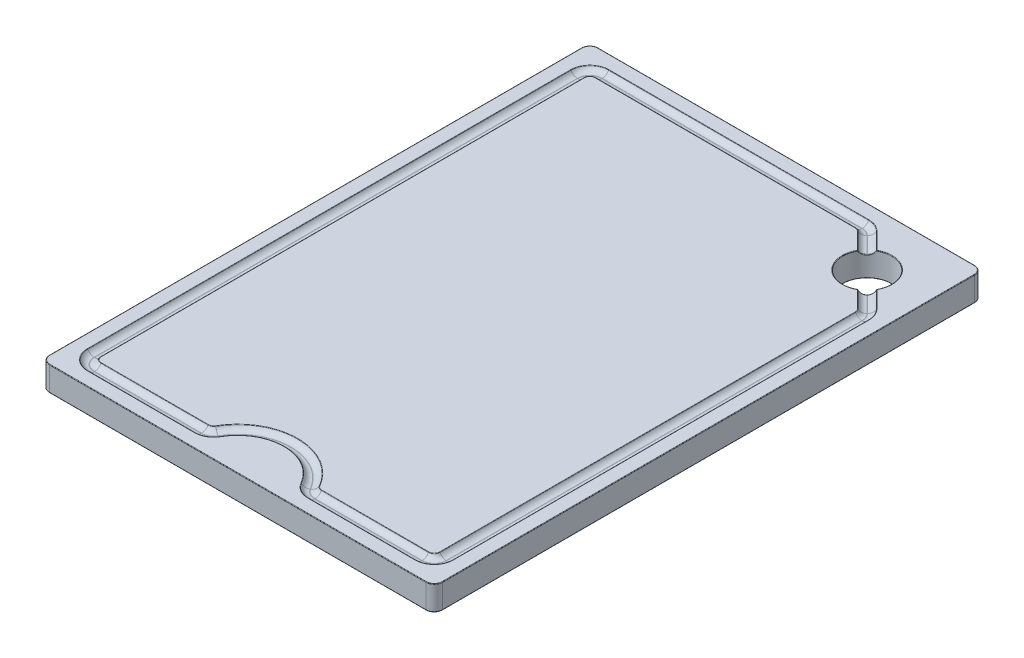
from build123d import *

# Parameters (mm, degrees)
BOARDBOSS_EXTRUDE_DEPTH         = 3.175
BOARDBOSS_EXTRUDE_DEPTH_BACK    = 15.875
CUTTINGBOARDSKETCH_W            = 304.8
CUTTINGBOARDSKETCH_H            = 425.45
BOARDDRAINCUT_EXTRUDE_START     = 3.175
BOARDDRAINCUT_EXTRUDE_DEPTH     = 3.175
BOARDDRAINFILLET_R              = 5.55625
BOARDHOLECUT_EXTRUDE_DEPTH      = 564.49765472
BOARDHOLECUT_EXTRUDE_DEPTH_BACK = 564.49765472
CUTTINGBOARDSKETCH_4_R          = 19.05
BOARDCORNERSFILLET_R            = 6.35
FINISHINGFILLET_R               = 0.396875


with BuildPart() as part:
    # CuttingBoardSketch → BoardBoss-Extrude (new, two sides: drawn at the far end of the back side and taken through both)
    with BuildSketch(Plane(origin=(0, 0, 0), x_dir=(1, 0, 0), z_dir=(0, 1, 0)).offset(-BOARDBOSS_EXTRUDE_DEPTH_BACK)):
        with Locations((180.975, 241.3)):
            Rectangle(CUTTINGBOARDSKETCH_W, CUTTINGBOARDSKETCH_H)
    extrude(amount=BOARDBOSS_EXTRUDE_DEPTH + BOARDBOSS_EXTRUDE_DEPTH_BACK)

    # CuttingBoardSketch<3> → BoardDrainCut-Extrude (cut)
    with BuildSketch(Plane(origin=(0, 0, 0), x_dir=(1, 0, 0), z_dir=(0, 1, 0)).offset(BOARDDRAINCUT_EXTRUDE_START)):
        with BuildLine():
            Line((255.610865818, 443.309375), (53.975, 443.309375))
            ThreePointArc((53.975, 443.309375), (43.59157886, 439.00842114), (39.290625, 428.625))
            Line((39.290625, 428.625), (39.290625, 53.975))
            ThreePointArc((39.290625, 53.975), (43.59157886, 43.59157886), (53.975, 39.290625))
            Line((53.975, 39.290625), (136.980909488, 39.290625))
            ThreePointArc((136.980909488, 39.290625), (144.323096988, 41.257958211), (149.697951276, 46.6328125))
            ThreePointArc((149.697951276, 46.6328125), (180.975, 64.690625), (212.252048724, 46.6328125))
            ThreePointArc((212.252048724, 46.6328125), (217.626903012, 41.257958211), (224.969090512, 39.290625))
            Line((224.969090512, 39.290625), (307.975, 39.290625))
            ThreePointArc((307.975, 39.290625), (318.35842114, 43.59157886), (322.659375, 53.975))
            Line((322.659375, 53.975), (322.659375, 376.260865818))
            ThreePointArc((322.659375, 376.260865818), (321.54159351, 381.880332846), (318.35842114, 386.644286958))
            Line((318.35842114, 386.644286958), (265.994286958, 439.00842114))
            ThreePointArc((265.994286958, 439.00842114), (261.230332846, 442.19159351), (255.610865818, 443.309375))
        make_face()
        with BuildLine():
            Line((255.610865818, 432.990625), (53.975, 432.990625))
            ThreePointArc((53.975, 432.990625), (50.888036958, 431.711963042), (49.609375, 428.625))
            Line((49.609375, 428.625), (49.609375, 53.975))
            ThreePointArc((49.609375, 53.975), (50.888036958, 50.888036958), (53.975, 49.609375))
            Line((53.975, 49.609375), (136.980909488, 49.609375))
            ThreePointArc((136.980909488, 49.609375), (139.163721988, 50.194257847), (140.761651641, 51.7921875))
            ThreePointArc((140.761651641, 51.7921875), (180.975, 75.009375), (221.188348359, 51.7921875))
            ThreePointArc((221.188348359, 51.7921875), (222.786278012, 50.194257847), (224.969090512, 49.609375))
            Line((224.969090512, 49.609375), (307.975, 49.609375))
            ThreePointArc((307.975, 49.609375), (311.061963042, 50.888036958), (312.340625, 53.975))
            Line((312.340625, 53.975), (312.340625, 376.260865818))
            ThreePointArc((312.340625, 376.260865818), (312.008311584, 377.931518178), (311.061963042, 379.34782886))
            Line((311.061963042, 379.34782886), (258.69782886, 431.711963042))
            ThreePointArc((258.69782886, 431.711963042), (257.281518178, 432.658311584), (255.610865818, 432.990625))
        make_face(mode=Mode.SUBTRACT)
    extrude(amount=-BOARDDRAINCUT_EXTRUDE_DEPTH, mode=Mode.SUBTRACT)

    # BoardDrainFillet
    # the kernel refuses this fillet: 5.55625 mm, written as the material it adds along each edge
    with BuildSketch(Plane(origin=(255.610865818, 0, -428.625), x_dir=(0.7071067811863847, 0, -0.7071067811867102), z_dir=(0.7071067811867102, 0, 0.7071067811863847))) as boarddrainfillet_piece_1:
        with BuildLine():
            CenterArc((9.385740786, 5.55625), BOARDDRAINFILLET_R, 205.376933525, 64.623066475)
            Line((4.365625, 3.175), (4.265222684, 3.127375))
            ThreePointArc((4.265222684, 3.127375), (4.2545, 1.5875), (4.2545, 0))
            Line((4.2545, 0), (4.365625, -0.111125))
            Line((4.365625, -0.111125), (9.385740786, -0.111125))
            Line((9.385740786, -0.111125), (9.385740786, 0))
        make_face()
    revolve(axis=Axis((255.610865818, 0, -428.625), (0, 1, 0)), revolution_arc=45)
    with BuildSketch(Plane(origin=(255.610865818, 0, -432.990625), x_dir=(0, 0, -1), z_dir=(-1, 0, 0))) as boarddrainfillet_piece_2:
        with BuildLine():
            CenterArc((5.020115786, -5.55625), BOARDDRAINFILLET_R, 90, 64.623066475)
            Line((0, -3.175), (-0.100402316, -3.127375))
            ThreePointArc((-0.100402316, -3.127375), (-0.111125, -1.5875), (-0.111125, 0))
            Line((-0.111125, 0), (0, 0.111125))
            Line((0, 0.111125), (5.020115786, 0.111125))
            Line((5.020115786, 0.111125), (5.020115786, 0))
        make_face()
    extrude(amount=201.635865818)
    with BuildSketch(Plane(origin=(53.975, 0, -428.625), x_dir=(0, 0, -1), z_dir=(1, 0, 0))) as boarddrainfillet_piece_3:
        with BuildLine():
            CenterArc((9.385740786, 5.55625), BOARDDRAINFILLET_R, 205.376933525, 64.623066475)
            Line((4.365625, 3.175), (4.265222684, 3.127375))
            ThreePointArc((4.265222684, 3.127375), (4.2545, 1.5875), (4.2545, 0))
            Line((4.2545, 0), (4.365625, -0.111125))
            Line((4.365625, -0.111125), (9.385740786, -0.111125))
            Line((9.385740786, -0.111125), (9.385740786, 0))
        make_face()
    revolve(axis=Axis((53.975, 0, -428.625), (0, 1, 0)), revolution_arc=90)
    with BuildSketch(Plane(origin=(49.609375, 0, -428.625), x_dir=(-1, 0, 0), z_dir=(0, 0, 1))) as boarddrainfillet_piece_4:
        with BuildLine():
            CenterArc((5.020115786, -5.55625), BOARDDRAINFILLET_R, 90, 64.623066475)
            Line((0, -3.175), (-0.100402316, -3.127375))
            ThreePointArc((-0.100402316, -3.127375), (-0.111125, -1.5875), (-0.111125, 0))
            Line((-0.111125, 0), (0, 0.111125))
            Line((0, 0.111125), (5.020115786, 0.111125))
            Line((5.020115786, 0.111125), (5.020115786, 0))
        make_face()
    extrude(amount=374.65)
    with BuildSketch(Plane(origin=(53.975, 0, -53.975), x_dir=(-1, 0, 0), z_dir=(0, 0, -1))) as boarddrainfillet_piece_5:
        with BuildLine():
            CenterArc((9.385740786, 5.55625), BOARDDRAINFILLET_R, 205.376933525, 64.623066475)
            Line((4.365625, 3.175), (4.265222684, 3.127375))
            ThreePointArc((4.265222684, 3.127375), (4.2545, 1.5875), (4.2545, 0))
            Line((4.2545, 0), (4.365625, -0.111125))
            Line((4.365625, -0.111125), (9.385740786, -0.111125))
            Line((9.385740786, -0.111125), (9.385740786, 0))
        make_face()
    revolve(axis=Axis((53.975, 0, -53.975), (0, 1, 0)), revolution_arc=90)
    with BuildSketch(Plane(origin=(53.975, 0, -49.609375), x_dir=(0, 0, 1), z_dir=(1, 0, 0)), Plane(origin=(224.969090512, 0, -49.609375), x_dir=(0, 0, 1), z_dir=(1, 0, 0))) as boarddrainfillet_piece_6:
        with BuildLine():
            CenterArc((5.020115786, -5.55625), BOARDDRAINFILLET_R, 90, 64.623066475)
            Line((0, -3.175), (-0.100402316, -3.127375))
            ThreePointArc((-0.100402316, -3.127375), (-0.111125, -1.5875), (-0.111125, 0))
            Line((-0.111125, 0), (0, 0.111125))
            Line((0, 0.111125), (5.020115786, 0.111125))
            Line((5.020115786, 0.111125), (5.020115786, 0))
        make_face()
    extrude(amount=83.005909488)
    with BuildSketch(Plane(origin=(136.980909488, 0, -53.975), x_dir=(0, 0, 1), z_dir=(-1, 0, 0))) as boarddrainfillet_piece_7:
        with BuildLine():
            CenterArc((9.385740786, 5.55625), BOARDDRAINFILLET_R, 205.376933525, 64.623066475)
            Line((4.365625, 3.175), (4.265222684, 3.127375))
            ThreePointArc((4.265222684, 3.127375), (4.2545, 1.5875), (4.2545, 0))
            Line((4.2545, 0), (4.365625, -0.111125))
            Line((4.365625, -0.111125), (9.385740786, -0.111125))
            Line((9.385740786, -0.111125), (9.385740786, 0))
        make_face()
    revolve(axis=Axis((136.980909488, 0, -53.975), (0, 1, 0)), revolution_arc=60)
    with BuildSketch(Plane(origin=(180.975, 0, -28.575), x_dir=(-0.8660254037844385, 0, -0.5000000000000006), z_dir=(-0.5000000000000006, 0, 0.8660254037844385))) as boarddrainfillet_piece_8:
        with BuildLine():
            CenterArc((41.414259214, -5.55625), BOARDDRAINFILLET_R, 25.376933525, 64.623066475)
            Line((46.434375, -3.175), (46.534777316, -3.127375))
            ThreePointArc((46.534777316, -3.127375), (46.5455, -1.5875), (46.5455, 0))
            Line((46.5455, 0), (46.434375, 0.111125))
            Line((46.434375, 0.111125), (41.414259214, 0.111125))
            Line((41.414259214, 0.111125), (41.414259214, 0))
        make_face()
    revolve(axis=Axis((180.975, 0, -28.575), (0, -1, 0)), revolution_arc=120)
    with BuildSketch(Plane(origin=(224.969090512, 0, -53.975), x_dir=(-0.866025403784443, 0, 0.49999999999999256), z_dir=(-0.49999999999999256, 0, -0.866025403784443))) as boarddrainfillet_piece_9:
        with BuildLine():
            CenterArc((9.385740786, 5.55625), BOARDDRAINFILLET_R, 205.376933525, 64.623066475)
            Line((4.365625, 3.175), (4.265222684, 3.127375))
            ThreePointArc((4.265222684, 3.127375), (4.2545, 1.5875), (4.2545, 0))
            Line((4.2545, 0), (4.365625, -0.111125))
            Line((4.365625, -0.111125), (9.385740786, -0.111125))
            Line((9.385740786, -0.111125), (9.385740786, 0))
        make_face()
    revolve(axis=Axis((224.969090512, 0, -53.975), (0, 1, 0)), revolution_arc=60)
    with BuildSketch(Plane(origin=(307.975, 0, -53.975), x_dir=(0, 0, 1), z_dir=(-1, 0, 0))) as boarddrainfillet_piece_10:
        with BuildLine():
            CenterArc((9.385740786, 5.55625), BOARDDRAINFILLET_R, 205.376933525, 64.623066475)
            Line((4.365625, 3.175), (4.265222684, 3.127375))
            ThreePointArc((4.265222684, 3.127375), (4.2545, 1.5875), (4.2545, 0))
            Line((4.2545, 0), (4.365625, -0.111125))
            Line((4.365625, -0.111125), (9.385740786, -0.111125))
            Line((9.385740786, -0.111125), (9.385740786, 0))
        make_face()
    revolve(axis=Axis((307.975, 0, -53.975), (0, 1, 0)), revolution_arc=90)
    with BuildSketch(Plane(origin=(312.340625, 0, -53.975), x_dir=(1, 0, 0), z_dir=(0, 0, -1))) as boarddrainfillet_piece_11:
        with BuildLine():
            CenterArc((5.020115786, -5.55625), BOARDDRAINFILLET_R, 90, 64.623066475)
            Line((0, -3.175), (-0.100402316, -3.127375))
            ThreePointArc((-0.100402316, -3.127375), (-0.111125, -1.5875), (-0.111125, 0))
            Line((-0.111125, 0), (0, 0.111125))
            Line((0, 0.111125), (5.020115786, 0.111125))
            Line((5.020115786, 0.111125), (5.020115786, 0))
        make_face()
    extrude(amount=322.285865818)
    with BuildSketch(Plane(origin=(307.975, 0, -376.260865818), x_dir=(1, 0, 0), z_dir=(0, 0, 1))) as boarddrainfillet_piece_12:
        with BuildLine():
            CenterArc((9.385740786, 5.55625), BOARDDRAINFILLET_R, 205.376933525, 64.623066475)
            Line((4.365625, 3.175), (4.265222684, 3.127375))
            ThreePointArc((4.265222684, 3.127375), (4.2545, 1.5875), (4.2545, 0))
            Line((4.2545, 0), (4.365625, -0.111125))
            Line((4.365625, -0.111125), (9.385740786, -0.111125))
            Line((9.385740786, -0.111125), (9.385740786, 0))
        make_face()
    revolve(axis=Axis((307.975, 0, -376.260865818), (0, 1, 0)), revolution_arc=45)
    with BuildSketch(Plane(origin=(311.061963042, 0, -379.34782886), x_dir=(0.7071067811865483, 0, -0.7071067811865468), z_dir=(-0.7071067811865468, 0, -0.7071067811865483))) as boarddrainfillet_piece_13:
        with BuildLine():
            CenterArc((5.020115786, -5.55625), BOARDDRAINFILLET_R, 90, 64.623066475)
            Line((0, -3.175), (-0.100402316, -3.127375))
            ThreePointArc((-0.100402316, -3.127375), (-0.111125, -1.5875), (-0.111125, 0))
            Line((-0.111125, 0), (0, 0.111125))
            Line((0, 0.111125), (5.020115786, 0.111125))
            Line((5.020115786, 0.111125), (5.020115786, 0))
        make_face()
    extrude(amount=74.054068742)
    with BuildSketch(Plane(origin=(53.975, 0, -39.290625), x_dir=(0, 1, 0), z_dir=(1, 0, 0)), Plane(origin=(224.969090512, 0, -39.290625), x_dir=(0, 1, 0), z_dir=(1, 0, 0))) as boarddrainfillet_piece_14:
        with BuildLine():
            CenterArc((5.55625, -5.020115786), BOARDDRAINFILLET_R, 115.376933525, 64.623066475)
            Line((0, -5.020115786), (-0.111125, -5.020115786))
            Line((-0.111125, -5.020115786), (-0.111125, 0))
            Line((-0.111125, 0), (0, 0.111125))
            ThreePointArc((0, 0.111125), (1.5875, 0.111125), (3.127375, 0.100402316))
            Line((3.127375, 0.100402316), (3.175, 0))
        make_face()
    extrude(amount=83.005909488)
    with BuildSketch(Plane(origin=(53.975, 0, -53.975), x_dir=(-1, 0, 0), z_dir=(0, 0, -1))) as boarddrainfillet_piece_15:
        with BuildLine():
            CenterArc((9.664259214, 5.55625), BOARDDRAINFILLET_R, 270, 64.623066475)
            Line((9.664259214, 0), (9.664259214, -0.111125))
            Line((9.664259214, -0.111125), (14.684375, -0.111125))
            Line((14.684375, -0.111125), (14.7955, 0))
            ThreePointArc((14.7955, 0), (14.7955, 1.5875), (14.784777316, 3.127375))
            Line((14.784777316, 3.127375), (14.684375, 3.175))
        make_face()
    revolve(axis=Axis((53.975, 0, -53.975), (0, 1, 0)), revolution_arc=90)
    with BuildSketch(Plane(origin=(39.290625, 0, -428.625), x_dir=(0, 1, 0), z_dir=(0, 0, 1))) as boarddrainfillet_piece_16:
        with BuildLine():
            CenterArc((5.55625, -5.020115786), BOARDDRAINFILLET_R, 115.376933525, 64.623066475)
            Line((0, -5.020115786), (-0.111125, -5.020115786))
            Line((-0.111125, -5.020115786), (-0.111125, 0))
            Line((-0.111125, 0), (0, 0.111125))
            ThreePointArc((0, 0.111125), (1.5875, 0.111125), (3.127375, 0.100402316))
            Line((3.127375, 0.100402316), (3.175, 0))
        make_face()
    extrude(amount=374.65)
    with BuildSketch(Plane(origin=(53.975, 0, -428.625), x_dir=(0, 0, -1), z_dir=(1, 0, 0))) as boarddrainfillet_piece_17:
        with BuildLine():
            CenterArc((9.664259214, 5.55625), BOARDDRAINFILLET_R, 270, 64.623066475)
            Line((9.664259214, 0), (9.664259214, -0.111125))
            Line((9.664259214, -0.111125), (14.684375, -0.111125))
            Line((14.684375, -0.111125), (14.7955, 0))
            ThreePointArc((14.7955, 0), (14.7955, 1.5875), (14.784777316, 3.127375))
            Line((14.784777316, 3.127375), (14.684375, 3.175))
        make_face()
    revolve(axis=Axis((53.975, 0, -428.625), (0, 1, 0)), revolution_arc=90)
    with BuildSketch(Plane(origin=(255.610865818, 0, -443.309375), x_dir=(0, 1, 0), z_dir=(-1, 0, 0))) as boarddrainfillet_piece_18:
        with BuildLine():
            CenterArc((5.55625, -5.020115786), BOARDDRAINFILLET_R, 115.376933525, 64.623066475)
            Line((0, -5.020115786), (-0.111125, -5.020115786))
            Line((-0.111125, -5.020115786), (-0.111125, 0))
            Line((-0.111125, 0), (0, 0.111125))
            ThreePointArc((0, 0.111125), (1.5875, 0.111125), (3.127375, 0.100402316))
            Line((3.127375, 0.100402316), (3.175, 0))
        make_face()
    extrude(amount=201.635865818)
    with BuildSketch(Plane(origin=(255.610865818, 0, -428.625), x_dir=(0.7071067811865175, 0, -0.7071067811865775), z_dir=(0.7071067811865775, 0, 0.7071067811865175))) as boarddrainfillet_piece_19:
        with BuildLine():
            CenterArc((9.664259214, 5.55625), BOARDDRAINFILLET_R, 270, 64.623066475)
            Line((9.664259214, 0), (9.664259214, -0.111125))
            Line((9.664259214, -0.111125), (14.684375, -0.111125))
            Line((14.684375, -0.111125), (14.7955, 0))
            ThreePointArc((14.7955, 0), (14.7955, 1.5875), (14.784777316, 3.127375))
            Line((14.784777316, 3.127375), (14.684375, 3.175))
        make_face()
    revolve(axis=Axis((255.610865818, 0, -428.625), (0, 1, 0)), revolution_arc=45)
    with BuildSketch(Plane(origin=(318.35842114, 0, -386.644286958), x_dir=(0, 1, 0), z_dir=(-0.7071067811865476, 0, -0.7071067811865476))) as boarddrainfillet_piece_20:
        with BuildLine():
            CenterArc((5.55625, -5.020115786), BOARDDRAINFILLET_R, 115.376933525, 64.623066475)
            Line((0, -5.020115786), (-0.111125, -5.020115786))
            Line((-0.111125, -5.020115786), (-0.111125, 0))
            Line((-0.111125, 0), (0, 0.111125))
            ThreePointArc((0, 0.111125), (1.5875, 0.111125), (3.127375, 0.100402316))
            Line((3.127375, 0.100402316), (3.175, 0))
        make_face()
    extrude(amount=74.054068742)
    with BuildSketch(Plane(origin=(307.975, 0, -376.260865818), x_dir=(1, 0, 0), z_dir=(0, 0, 1))) as boarddrainfillet_piece_21:
        with BuildLine():
            CenterArc((9.664259214, 5.55625), BOARDDRAINFILLET_R, 270, 64.623066475)
            Line((9.664259214, 0), (9.664259214, -0.111125))
            Line((9.664259214, -0.111125), (14.684375, -0.111125))
            Line((14.684375, -0.111125), (14.7955, 0))
            ThreePointArc((14.7955, 0), (14.7955, 1.5875), (14.784777316, 3.127375))
            Line((14.784777316, 3.127375), (14.684375, 3.175))
        make_face()
    revolve(axis=Axis((307.975, 0, -376.260865818), (0, 1, 0)), revolution_arc=45)
    with BuildSketch(Plane(origin=(322.659375, 0, -53.975), x_dir=(0, 1, 0), z_dir=(0, 0, -1))) as boarddrainfillet_piece_22:
        with BuildLine():
            CenterArc((5.55625, -5.020115786), BOARDDRAINFILLET_R, 115.376933525, 64.623066475)
            Line((0, -5.020115786), (-0.111125, -5.020115786))
            Line((-0.111125, -5.020115786), (-0.111125, 0))
            Line((-0.111125, 0), (0, 0.111125))
            ThreePointArc((0, 0.111125), (1.5875, 0.111125), (3.127375, 0.100402316))
            Line((3.127375, 0.100402316), (3.175, 0))
        make_face()
    extrude(amount=322.285865818)
    with BuildSketch(Plane(origin=(307.975, 0, -53.975), x_dir=(0, 0, 1), z_dir=(-1, 0, 0))) as boarddrainfillet_piece_23:
        with BuildLine():
            CenterArc((9.664259214, 5.55625), BOARDDRAINFILLET_R, 270, 64.623066475)
            Line((9.664259214, 0), (9.664259214, -0.111125))
            Line((9.664259214, -0.111125), (14.684375, -0.111125))
            Line((14.684375, -0.111125), (14.7955, 0))
            ThreePointArc((14.7955, 0), (14.7955, 1.5875), (14.784777316, 3.127375))
            Line((14.784777316, 3.127375), (14.684375, 3.175))
        make_face()
    revolve(axis=Axis((307.975, 0, -53.975), (0, 1, 0)), revolution_arc=90)
    with BuildSketch(Plane(origin=(224.969090512, 0, -53.975), x_dir=(-0.8660254037844408, 0, 0.49999999999999634), z_dir=(-0.49999999999999634, 0, -0.8660254037844408))) as boarddrainfillet_piece_24:
        with BuildLine():
            CenterArc((9.664259214, 5.55625), BOARDDRAINFILLET_R, 270, 64.623066475)
            Line((9.664259214, 0), (9.664259214, -0.111125))
            Line((9.664259214, -0.111125), (14.684375, -0.111125))
            Line((14.684375, -0.111125), (14.7955, 0))
            ThreePointArc((14.7955, 0), (14.7955, 1.5875), (14.784777316, 3.127375))
            Line((14.784777316, 3.127375), (14.684375, 3.175))
        make_face()
    revolve(axis=Axis((224.969090512, 0, -53.975), (0, 1, 0)), revolution_arc=60)
    with BuildSketch(Plane(origin=(180.975, 0, -28.575), x_dir=(-0.8660254037844379, 0, -0.5000000000000011), z_dir=(-0.5000000000000011, 0, 0.8660254037844379))) as boarddrainfillet_piece_25:
        with BuildLine():
            CenterArc((41.135740786, -5.55625), BOARDDRAINFILLET_R, 90, 64.623066475)
            Line((41.135740786, 0), (41.135740786, 0.111125))
            Line((41.135740786, 0.111125), (36.115625, 0.111125))
            Line((36.115625, 0.111125), (36.0045, 0))
            ThreePointArc((36.0045, 0), (36.0045, -1.5875), (36.015222684, -3.127375))
            Line((36.015222684, -3.127375), (36.115625, -3.175))
        make_face()
    revolve(axis=Axis((180.975, 0, -28.575), (0, -1, 0)), revolution_arc=120)
    with BuildSketch(Plane(origin=(136.980909488, 0, -53.975), x_dir=(0, 0, 1), z_dir=(-1, 0, 0))) as boarddrainfillet_piece_26:
        with BuildLine():
            CenterArc((9.664259214, 5.55625), BOARDDRAINFILLET_R, 270, 64.623066475)
            Line((9.664259214, 0), (9.664259214, -0.111125))
            Line((9.664259214, -0.111125), (14.684375, -0.111125))
            Line((14.684375, -0.111125), (14.7955, 0))
            ThreePointArc((14.7955, 0), (14.7955, 1.5875), (14.784777316, 3.127375))
            Line((14.784777316, 3.127375), (14.684375, 3.175))
        make_face()
    revolve(axis=Axis((136.980909488, 0, -53.975), (0, 1, 0)), revolution_arc=60)

    # CuttingBoardSketch<4> → BoardHoleCut-Extrude (cut, two sides: drawn at the far end of the back side and taken through both)
    with BuildSketch(Plane(origin=(0, 0, 0), x_dir=(1, 0, 0), z_dir=(0, 1, 0)).offset(-BOARDHOLECUT_EXTRUDE_DEPTH_BACK)):
        with Locations(Location((288.528125, 409.178125, 0), (0, 0, 270))):
            Circle(CUTTINGBOARDSKETCH_4_R)
    extrude(amount=BOARDHOLECUT_EXTRUDE_DEPTH + BOARDHOLECUT_EXTRUDE_DEPTH_BACK, mode=Mode.SUBTRACT)

    # BoardCornersFillet
    boardcornersfillet_edges = [part.edges().sort_by_distance(p)[0] for p in [
        (28.575, -6.35, -454.025),
        (28.575, -6.35, -28.575),
        (333.375, -6.35, -28.575),
        (333.375, -6.35, -454.025),
    ]]
    fillet(boardcornersfillet_edges, radius=BOARDCORNERSFILLET_R)

    # FinishingFillet
    finishingfillet_edges = [part.edges().sort_by_distance(p)[0] for p in [
        (272.601847769, 3.175, -432.400860329),
        (304.021469587, 0.865785832, -398.093957321),
        (277.443957321, 0.865785831, -424.671469587),
        (265.305389671, 3.175, -425.104402231),
        (288.528125, -15.875, -428.228125),
        (273.034780413, 0.865785832, -420.262292679),
        (299.612292679, 0.865785831, -393.684780413),
        (275.057740818, 0, -422.648509182),
        (272.089997859, 3.175, -399.550535681),
        (301.998509182, 3.175, -422.648509182),
        (301.998509182, 0, -395.707740818),
        (333.375, -15.875, -241.3),
        (333.375, 3.175, -241.3),
        (180.975, -15.875, -454.025),
        (180.975, -15.875, -28.575),
        (28.575, -15.875, -241.3),
        (331.515128061, -15.875, -452.165128061),
        (30.434871939, -15.875, -452.165128061),
        (30.434871939, -15.875, -30.434871939),
        (331.515128061, -15.875, -30.434871939),
        (180.975, 3.175, -28.575),
        (180.975, 3.175, -454.025),
        (28.575, 3.175, -241.3),
        (331.515128061, 3.175, -452.165128061),
        (30.434871939, 3.175, -452.165128061),
        (30.434871939, 3.175, -30.434871939),
        (331.515128061, 3.175, -30.434871939),
        (304.454402231, 3.175, -385.955389671),
        (154.792932909, 3.175, -432.990625),
        (49.609375, 3.175, -241.3),
        (50.888036958, 3.175, -50.888036958),
        (95.477954744, 3.175, -49.609375),
        (139.163721988, 3.175, -50.194257847),
        (180.975, 3.175, -75.009375),
        (222.786278012, 3.175, -50.194257847),
        (266.472045256, 3.175, -49.609375),
        (312.340625, 3.175, -215.117932909),
        (43.59157886, 3.175, -439.00842114),
        (261.230332846, 3.175, -442.19159351),
        (318.35842114, 3.175, -43.59157886),
        (312.008311584, 3.175, -377.931518178),
        (144.323096988, 3.175, -41.257958211),
        (180.975, 3.175, -64.690625),
        (217.626903012, 3.175, -41.257958211),
        (266.472045256, 3.175, -39.290625),
        (322.659375, 3.175, -215.117932909),
        (321.54159351, 3.175, -381.880332846),
        (311.750860329, 3.175, -393.251847769),
        (154.792932909, 3.175, -443.309375),
        (39.290625, 3.175, -241.3),
        (43.59157886, 3.175, -43.59157886),
        (95.477954744, 3.175, -39.290625),
        (311.061963042, 3.175, -50.888036958),
        (50.888036958, 3.175, -431.711963042),
        (257.281518178, 3.175, -432.658311584),
    ]]
    fillet(finishingfillet_edges, radius=FINISHINGFILLET_R)


solid = part.part
